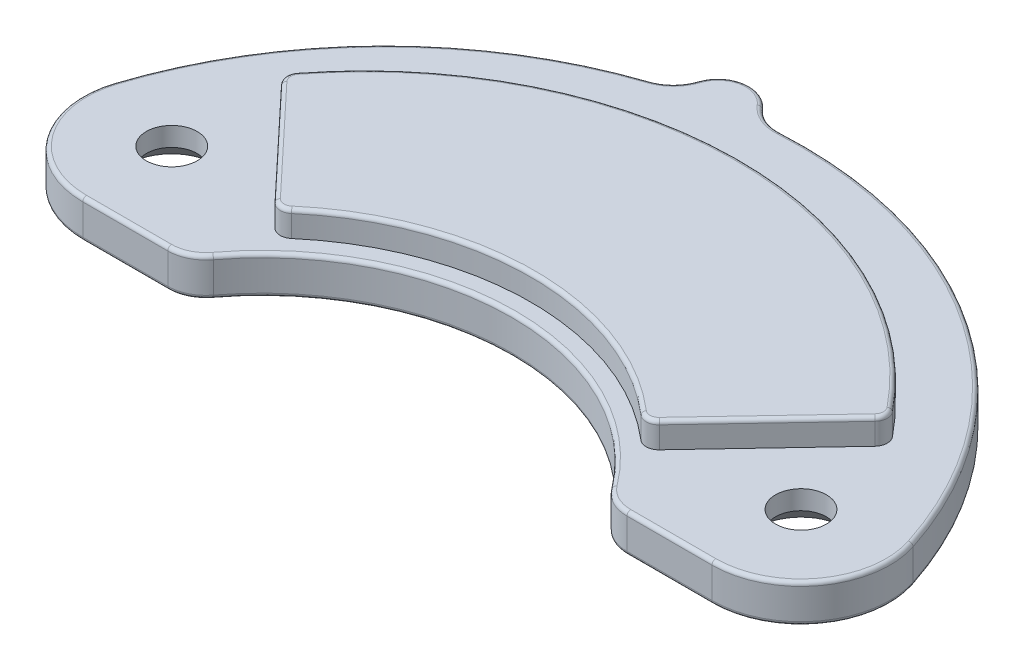
from build123d import *

# Parameters (mm, degrees)
SKETCH_1_R       = 1.9999999999999996
EXTRUDE_1_DEPTH  = 3
FILLET_1_R       = 0.3
CHAMFER_2_SIZE   = 1.5
EXTRUDE_2_DEPTH  = 2
FILLET_2_R       = 0.3
FILLET_START     = 2
FILLET_3_DEPTH   = 4
FILLET_3_2_ANGLE = 87.409478
FILLET_3_3_ANGLE = 80.898362
FILLET_3_4_ANGLE = 82.306392
FILLET_3_5_ANGLE = 87.235371


with BuildPart() as part:
    # Эскиз1 → Бобышка-Вытянуть1 (new body)
    with BuildSketch(Plane(origin=(0, 0, 0), x_dir=(1, 0, 0), z_dir=(0, 1, 0))):
        with BuildLine():
            Line((-24.74999999999514, 0), (-18.062391868178377, 0))
            ThreePointArc((-18.062391868178377, 0), (-16.724462404933302, 0.3148659714307076), (-15.667378581788512, 1.1933701657461677))
            ThreePointArc((-15.667378581788512, 1.1933701657461677), (7.11099e-12, 8.999999999999984), (15.667378581802726, 1.1933701657461642))
            ThreePointArc((15.667378581802726, 1.1933701657461642), (16.724462404947516, 0.3148659714307094), (18.06239186819259, 0))
            Line((18.06239186819259, 0), (24.74999999999514, 0))
            ThreePointArc((24.74999999999514, 0), (30.41115259011707, 2.8827981162741514), (31.409459459454997, 9.156756756755511))
            ThreePointArc((31.409459459454997, 9.156756756755511), (18.673909826346378, 26.211504594175647), (-1.8232287049257414, 31.949619291983687))
            ThreePointArc((-1.8232287049257414, 31.949619291983687), (-3.181872515199863, 32.192440336878796), (-4.288020016358429, 33.0178570611586))
            ThreePointArc((-4.288020016358429, 33.0178570611586), (-6.673728899130579, 33.86733590817873), (-8.577395305578529, 32.19722351739955))
            ThreePointArc((-8.577395305578529, 32.19722351739955), (-9.300744976260049, 31.02179154703082), (-10.473810036582254, 30.29460970781092))
            ThreePointArc((-10.473810036582254, 30.29460970781092), (-23.457499286252304, 22.21748114997415), (-31.409459459454997, 9.156756756755511))
            ThreePointArc((-31.409459459454997, 9.156756756755511), (-30.41115259011707, 2.8827981162741523), (-24.74999999999514, 0))
        make_face()
        with Locations(Location((-24.74999999999514, 7, 0), (0, 0, 270))):
            Circle(SKETCH_1_R, mode=Mode.SUBTRACT)
        with Locations(Location((24.74999999999514, 7, 0), (0, 0, 270))):
            Circle(SKETCH_1_R, mode=Mode.SUBTRACT)
    extrude(amount=EXTRUDE_1_DEPTH)

    # Скругление1
    fillet_1_edges = [part.edges().sort_by_distance(p)[0] for p in [
        (-16.724462404933302, 3, -0.3148659714307076),
        (-23.457499286252283, 0, -22.21748114997417),
        (-9.300744976260049, 0, -31.02179154703082),
        (-6.673728899130581, 0, -33.86733590817873),
        (-3.1818725151998644, 0, -32.192440336878796),
        (18.673909826346367, 0, -26.211504594175654),
        (30.41115259011707, 0, -2.8827981162741505),
        (7.10987e-12, 3, -8.99999999999998),
        (21.406195934093866, 0, 0),
        (16.724462404947516, 0, -0.3148659714307085),
        (7.10987e-12, 0, -8.99999999999998),
        (-16.724462404933302, 0, -0.3148659714307076),
        (-21.40619593408676, 0, 0),
        (-30.41115259011707, 0, -2.8827981162741514),
        (16.724462404947516, 3, -0.3148659714307085),
        (21.406195934093866, 3, 0),
        (30.41115259011707, 3, -2.8827981162741505),
        (18.673909826346367, 3, -26.211504594175654),
        (-3.1818725151998644, 3, -32.192440336878796),
        (-6.673728899130581, 3, -33.86733590817873),
        (-9.300744976260049, 3, -31.02179154703082),
        (-23.457499286252283, 3, -22.21748114997417),
        (-30.41115259011707, 3, -2.8827981162741514),
        (-21.40619593408676, 3, 0),
    ]]
    fillet(fillet_1_edges, radius=FILLET_1_R)

    # Фаска2
    chamfer_2_edges = [part.edges().sort_by_distance(p)[0] for p in [
        (-24.74999999999514, 0, -9),
        (24.74999999999514, 0, -9),
    ]]
    chamfer(chamfer_2_edges, length=CHAMFER_2_SIZE)


with BuildPart() as body_2:
    # Эскиз2 → Бобышка-Вытянуть2 (new body)
    with BuildSketch(Plane(origin=(0, 3, 0), x_dir=(1, 0, 0), z_dir=(0, 1, 0))):
        with BuildLine():
            Line((-23.432160134104283, 14.353847452342043), (-14.453012610993582, 4.782013061141572))
            ThreePointArc((-14.453012610993582, 4.782013061141572), (7.0692e-12, 10.499999999999913), (14.453012611007685, 4.782013061141572))
            Line((14.453012611007685, 4.782013061141572), (23.95204060293321, 14.843746221519005))
            ThreePointArc((23.95204060293321, 14.843746221519005), (0.13691164291233865, 26.498421500053468), (-23.432160134104283, 14.353847452342043))
        make_face()
    extrude(amount=EXTRUDE_2_DEPTH)

    # Скругление2
    fillet_2_edges = [body_2.edges().sort_by_distance(p)[0] for p in [
        (0.13691164291233893, 5, -26.498421500053468),
        (-18.94258637254893, 5, -9.567930256741807),
        (7.05214e-12, 5, -10.499999999999911),
        (19.202526606970448, 5, -9.812879641330287),
    ]]
    fillet(fillet_2_edges, radius=FILLET_2_R)

    # Скругление3: read off the stored shape, not the designer's step
    # Скругление3 outline → Скругление3 (cut)
    with BuildSketch(Plane(origin=(0, 0, 0), x_dir=(1, 0, 0), z_dir=(0, 1, 0)).offset(FILLET_START)):
        with BuildLine():
            ThreePointArc((-14.453012611, 4.782013061), (-14.101049536, 5.10478153), (-13.741880327, 5.419511525))
            ThreePointArc((-13.741880327, 5.419511525), (-14.446901286, 5.180502228), (-15.121709599, 5.494848752))
            Line((-15.121709599, 5.494848752), (-14.453012611, 4.782013061))
        make_face()
        with BuildLine():
            ThreePointArc((15.121889599, 5.490513107), (14.447602659, 5.178392621), (13.74413244, 5.41758235))
            ThreePointArc((13.74413244, 5.41758235), (14.102153536, 5.103791774), (14.453012611, 4.782013061))
            Line((14.453012611, 4.782013061), (15.121889599, 5.490513107))
        make_face()
        with BuildLine():
            Line((-23.432160134, 14.353847452), (-22.85744234, 13.741194243))
            ThreePointArc((-22.85744234, 13.741194243), (-23.126988908, 14.377889813), (-22.9190378, 15.037278118))
            ThreePointArc((-22.9190378, 15.037278118), (-23.178070893, 14.697418716), (-23.432160134, 14.353847452))
        make_face()
        with BuildLine():
            ThreePointArc((23.411558442, 15.532933405), (23.633172881, 14.865864012), (23.361056653, 14.217753456))
            Line((23.361056653, 14.217753456), (23.952040603, 14.843746222))
            ThreePointArc((23.952040603, 14.843746222), (23.684354184, 15.190343259), (23.411558442, 15.532933405))
        make_face()
    extrude(amount=FILLET_3_DEPTH, mode=Mode.SUBTRACT)

    # Fillet 3 2 outline → Fillet 3 2 (revolve, cut)
    with BuildSketch(Plane(origin=(-14.392383537, 0, -6.17901503), x_dir=(-0.7293260620658242, 0, 0.6841662774439833), z_dir=(-0.6841662774439833, 0, -0.7293260620658242))):
        with BuildLine():
            ThreePointArc((0.7, 5), (0.912132034, 4.912132034), (1, 4.7))
            Line((1, 4.7), (1, 5))
            Line((1, 5), (0.7, 5))
        make_face()
    revolve(axis=Axis((-14.392383537, 0, -6.17901503), (0, 1, 0)), revolution_arc=FILLET_3_2_ANGLE, mode=Mode.SUBTRACT)

    # Fillet 3 3 outline → Fillet 3 3 (revolve, cut)
    with BuildSketch(Plane(origin=(-22.128116278, 0, -14.42536052), x_dir=(-0.7909215222234117, 0, -0.6119175971352689), z_dir=(0.6119175971352689, 0, -0.7909215222234117))):
        with BuildLine():
            ThreePointArc((0.7, 5), (0.912132034, 4.912132034), (1, 4.7))
            Line((1, 4.7), (1, 5))
            Line((1, 5), (0.7, 5))
        make_face()
    revolve(axis=Axis((-22.128116278, 0, -14.42536052), (0, 1, 0)), revolution_arc=FILLET_3_3_ANGLE, mode=Mode.SUBTRACT)

    # Fillet 3 4 outline → Fillet 3 4 (revolve, cut)
    with BuildSketch(Plane(origin=(22.633909314, 0, -14.904234881), x_dir=(0.727147338715478, 0, 0.686481425676615), z_dir=(-0.686481425676615, 0, 0.727147338715478))):
        with BuildLine():
            ThreePointArc((0.7, 5), (0.912132034, 4.912132034), (1, 4.7))
            Line((1, 4.7), (1, 5))
            Line((1, 5), (0.7, 5))
        make_face()
    revolve(axis=Axis((22.633909314, 0, -14.904234881), (0, 0.9999999999999999, 0)), revolution_arc=FILLET_3_4_ANGLE, mode=Mode.SUBTRACT)

    # Fillet 3 5 outline → Fillet 3 5 (revolve, cut)
    with BuildSketch(Plane(origin=(14.39474226, 0, -6.176994533), x_dir=(-0.6506098196565728, 0, 0.7594121822610181), z_dir=(-0.7594121822610181, 0, -0.6506098196565728))):
        with BuildLine():
            ThreePointArc((0.7, 5), (0.912132034, 4.912132034), (1, 4.7))
            Line((1, 4.7), (1, 5))
            Line((1, 5), (0.7, 5))
        make_face()
    revolve(axis=Axis((14.39474226, 0, -6.176994533), (0, 1, 0)), revolution_arc=FILLET_3_5_ANGLE, mode=Mode.SUBTRACT)


solid = Compound([part.part, body_2.part])
